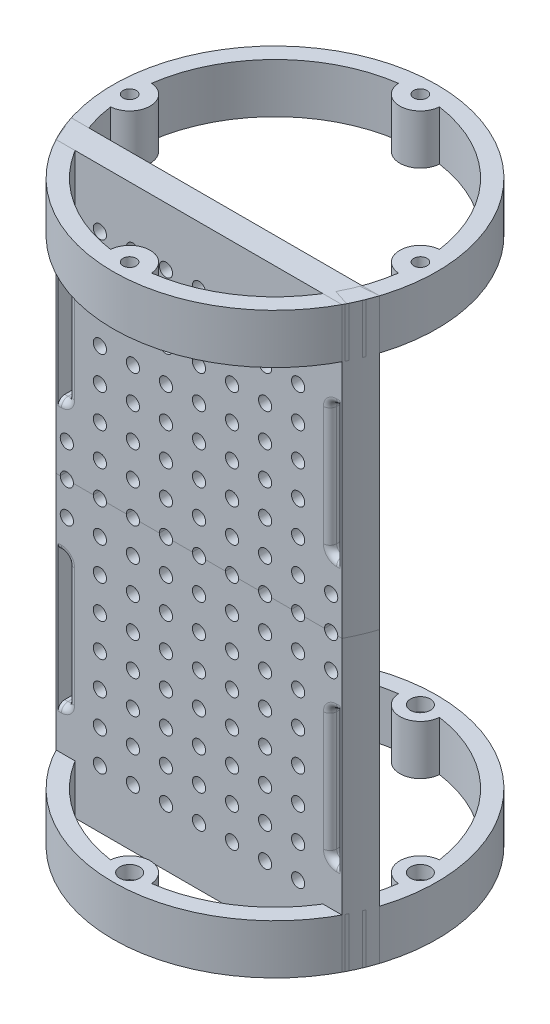
from build123d import *

# Parameters (mm, degrees)
SKETCH1_R                = 49
SKETCH1_R_2              = 1.55
BOSS_EXTRUDE1_DEPTH      = 15
BOSS_EXTRUDE2_DEPTH      = 72.5
BOSS_EXTRUDE2_DEPTH_BACK = 15
SKETCH3_R                = 3
CUT_EXTRUDE1_DEPTH       = 4
CIRPATTERN1_COUNT        = 4
SKETCH4_R                = 2
CUT_EXTRUDE2_DEPTH       = 15
CIRPATTERN2_COUNT        = 4
SKETCH6_R                = 2
CUT_EXTRUDE4_DEPTH       = 8
FILL_START               = 15
FILL_PATTERN1_OUTLINE_R  = 2
FILL_PATTERN1_DEPTH      = 8
SKETCH7_W                = 3
SKETCH7_H                = 40
CUT_EXTRUDE5_DEPTH       = 193.670703533
MIRROR9_COPY_1_SKETCH_W  = 3
MIRROR9_COPY_1_SKETCH_H  = 40
MIRROR9_COPY_1_DEPTH     = 193.670703533
FILLET2_R                = 2
FILLET3_R                = 2


# Read off the part's stored shape, not the designer's step: Fill Pattern1
with BuildPart() as part:
    # Sketch1 → Boss-Extrude1 (new body)
    with BuildSketch(Plane(origin=(0, 0, 0), x_dir=(1, 0, 0), z_dir=(0, 1, 0))):
        with Locations(Location((0, 0, 0), (0, 0, 270))):
            Circle(SKETCH1_R)
        with BuildLine():
            ThreePointArc((43.561522491, 6.196269703), (37.788235294, 0), (43.561522491, -6.196269703))
            ThreePointArc((43.561522491, -6.196269703), (31.112698372, -31.112698372), (6.196269703, -43.561522491))
            ThreePointArc((6.196269703, -43.561522491), (0, -37.788235294), (-6.196269703, -43.561522491))
            ThreePointArc((-6.196269703, -43.561522491), (-31.112698372, -31.112698372), (-43.561522491, -6.196269703))
            ThreePointArc((-43.561522491, -6.196269703), (-37.788235294, 0), (-43.561522491, 6.196269703))
            ThreePointArc((-43.561522491, 6.196269703), (-31.112698372, 31.112698372), (-6.196269703, 43.561522491))
            ThreePointArc((-6.196269703, 43.561522491), (0, 37.788235294), (6.196269703, 43.561522491))
            ThreePointArc((6.196269703, 43.561522491), (31.112698372, 31.112698372), (43.561522491, 6.196269703))
        make_face(mode=Mode.SUBTRACT)
        with Locations(Location((-44, 0, 0), (0, 0, 270))):
            Circle(SKETCH1_R_2, mode=Mode.SUBTRACT)
        with Locations(Location((0, -44, 0), (0, 0, 270))):
            Circle(SKETCH1_R_2, mode=Mode.SUBTRACT)
        with Locations(Location((0, 44, 0), (0, 0, 270))):
            Circle(SKETCH1_R_2, mode=Mode.SUBTRACT)
        with Locations(Location((44, 0, 0), (0, 0, 270))):
            Circle(SKETCH1_R_2, mode=Mode.SUBTRACT)
    extrude(amount=BOSS_EXTRUDE1_DEPTH)


with BuildPart() as body_2:
    # Sketch2 → Boss-Extrude2 (new, two sides: drawn at the far end of the back side and taken through both)
    with BuildSketch(Plane(origin=(0, 15, 0), x_dir=(1, 0, 0), z_dir=(0, 1, 0)).offset(-BOSS_EXTRUDE2_DEPTH_BACK)):
        with BuildLine():
            Line((-41.36423576, -15), (-46.647615159, -15))
            ThreePointArc((-46.647615159, -15), (-45.134711808, -19.07505675), (-43.266615306, -23))
            Line((-43.266615306, -23), (-37.509998667, -23))
            ThreePointArc((-37.509998667, -23), (-39.639452747, -19.09748114), (-41.36423576, -15))
        make_face()
        with BuildLine():
            Line((41.36423576, -15), (-41.36423576, -15))
            ThreePointArc((-41.36423576, -15), (-39.639452747, -19.09748114), (-37.509998667, -23))
            Line((-37.509998667, -23), (37.509998667, -23))
            ThreePointArc((37.509998667, -23), (39.639452747, -19.09748114), (41.36423576, -15))
        make_face()
        with BuildLine():
            Line((46.647615159, -15), (41.36423576, -15))
            ThreePointArc((41.36423576, -15), (39.639452747, -19.09748114), (37.509998667, -23))
            Line((37.509998667, -23), (43.266615306, -23))
            ThreePointArc((43.266615306, -23), (45.134711808, -19.07505675), (46.647615159, -15))
        make_face()
    extrude(amount=BOSS_EXTRUDE2_DEPTH + BOSS_EXTRUDE2_DEPTH_BACK)


with BuildPart() as body_3:
    # Mirror7: mirrored copy
    add(part.part.mirror(Plane(origin=(0, 87.5, 18.950111488), x_dir=(0, 0, 1), z_dir=(0, 1, 0))))

    # Sketch4 → Cut-Extrude2 (cut)
    with BuildSketch(Plane(origin=(0, 175, 0), x_dir=(1, 0, 0), z_dir=(0, 1, 0))):
        with Locations(Location((0, 44, 0), (0, 0, 270))):
            Circle(SKETCH4_R)
    cut_extrude2 = extrude(amount=-CUT_EXTRUDE2_DEPTH, mode=Mode.SUBTRACT)

    # CirPattern2: Cut-Extrude2 ×4 about axis
    cirpattern2_axis = Axis((0, 0, 0), (0, 1, 0))
    for i in range(1, CIRPATTERN2_COUNT):
        add(cut_extrude2.rotate(cirpattern2_axis, i * 360 / CIRPATTERN2_COUNT), mode=Mode.SUBTRACT)


with BuildPart() as body_4:
    # Mirror7 2: mirrored copy
    add(body_2.part.mirror(Plane(origin=(0, 87.5, 18.950111488), x_dir=(0, 0, 1), z_dir=(0, 1, 0))))


with BuildPart() as part_1:
    add(part.part)

    # Sketch3 → Cut-Extrude1 (cut)
    with BuildSketch(Plane(origin=(0, 15, 0), x_dir=(1, 0, 0), z_dir=(0, 1, 0))):
        with Locations(Location((0, 44, 0), (0, 0, 270))):
            Circle(SKETCH3_R)
    cut_extrude1 = extrude(amount=-CUT_EXTRUDE1_DEPTH, mode=Mode.SUBTRACT)

    # CirPattern1: Cut-Extrude1 ×4 about axis
    cirpattern1_axis = Axis((0, 0, 0), (0, 1, 0))
    for i in range(1, CIRPATTERN1_COUNT):
        add(cut_extrude1.rotate(cirpattern1_axis, i * 360 / CIRPATTERN1_COUNT), mode=Mode.SUBTRACT)


with BuildPart() as cut_extrude4_tool:
    # Sketch6 → Cut-Extrude4 (new body)
    with BuildSketch(Plane(origin=(0, 0, 15), x_dir=(-1, 0, 0), z_dir=(0, 0, -1))):
        with Locations((0, 87.5)):
            Circle(SKETCH6_R)
    extrude(amount=-CUT_EXTRUDE4_DEPTH)


with BuildPart() as body_2_1:
    add(body_2.part)

    # Cut-Extrude4: cut by cut_extrude4_tool
    add(cut_extrude4_tool.part, mode=Mode.SUBTRACT)


with BuildPart() as body_4_1:
    add(body_4.part)

    # Cut-Extrude4: cut by cut_extrude4_tool
    add(cut_extrude4_tool.part, mode=Mode.SUBTRACT)


with BuildPart() as fill_pattern1_tool:
    # Fill Pattern1 outline → Fill Pattern1 (new body)
    with BuildSketch(Plane.XY.offset(FILL_START)):
        with Locations((10, 97.5)):
            Circle(FILL_PATTERN1_OUTLINE_R)
        with Locations((0, 97.5)):
            Circle(FILL_PATTERN1_OUTLINE_R)
        with Locations((-10, 97.5)):
            Circle(FILL_PATTERN1_OUTLINE_R)
        with Locations((-10, 87.5)):
            Circle(FILL_PATTERN1_OUTLINE_R)
        with Locations((-40, 87.5)):
            Circle(FILL_PATTERN1_OUTLINE_R)
        with Locations((-30, 87.5)):
            Circle(FILL_PATTERN1_OUTLINE_R)
        with Locations((-20, 87.5)):
            Circle(FILL_PATTERN1_OUTLINE_R)
        with Locations((40, 87.5)):
            Circle(FILL_PATTERN1_OUTLINE_R)
        with Locations((30, 87.5)):
            Circle(FILL_PATTERN1_OUTLINE_R)
        with Locations((20, 87.5)):
            Circle(FILL_PATTERN1_OUTLINE_R)
        with Locations((10, 87.5)):
            Circle(FILL_PATTERN1_OUTLINE_R)
        with Locations((20, 107.5)):
            Circle(FILL_PATTERN1_OUTLINE_R)
        with Locations((10, 107.5)):
            Circle(FILL_PATTERN1_OUTLINE_R)
        with Locations((0, 107.5)):
            Circle(FILL_PATTERN1_OUTLINE_R)
        with Locations((-10, 107.5)):
            Circle(FILL_PATTERN1_OUTLINE_R)
        with Locations((-20, 107.5)):
            Circle(FILL_PATTERN1_OUTLINE_R)
        with Locations((-20, 97.5)):
            Circle(FILL_PATTERN1_OUTLINE_R)
        with Locations((20, 97.5)):
            Circle(FILL_PATTERN1_OUTLINE_R)
        with Locations((30, 117.5)):
            Circle(FILL_PATTERN1_OUTLINE_R)
        with Locations((20, 117.5)):
            Circle(FILL_PATTERN1_OUTLINE_R)
        with Locations((10, 117.5)):
            Circle(FILL_PATTERN1_OUTLINE_R)
        with Locations((0, 117.5)):
            Circle(FILL_PATTERN1_OUTLINE_R)
        with Locations((-10, 117.5)):
            Circle(FILL_PATTERN1_OUTLINE_R)
        with Locations((-20, 117.5)):
            Circle(FILL_PATTERN1_OUTLINE_R)
        with Locations((-30, 117.5)):
            Circle(FILL_PATTERN1_OUTLINE_R)
        with Locations((-30, 107.5)):
            Circle(FILL_PATTERN1_OUTLINE_R)
        with Locations((-30, 97.5)):
            Circle(FILL_PATTERN1_OUTLINE_R)
        with Locations((30, 97.5)):
            Circle(FILL_PATTERN1_OUTLINE_R)
        with Locations((30, 107.5)):
            Circle(FILL_PATTERN1_OUTLINE_R)
        with Locations((30, 127.5)):
            Circle(FILL_PATTERN1_OUTLINE_R)
        with Locations((20, 127.5)):
            Circle(FILL_PATTERN1_OUTLINE_R)
        with Locations((10, 127.5)):
            Circle(FILL_PATTERN1_OUTLINE_R)
        with Locations((0, 127.5)):
            Circle(FILL_PATTERN1_OUTLINE_R)
        with Locations((-10, 127.5)):
            Circle(FILL_PATTERN1_OUTLINE_R)
        with Locations((-20, 127.5)):
            Circle(FILL_PATTERN1_OUTLINE_R)
        with Locations((-30, 127.5)):
            Circle(FILL_PATTERN1_OUTLINE_R)
        with Locations((-40, 97.5)):
            Circle(FILL_PATTERN1_OUTLINE_R)
        with Locations((40, 97.5)):
            Circle(FILL_PATTERN1_OUTLINE_R)
        with Locations((30, 137.5)):
            Circle(FILL_PATTERN1_OUTLINE_R)
        with Locations((20, 137.5)):
            Circle(FILL_PATTERN1_OUTLINE_R)
        with Locations((10, 137.5)):
            Circle(FILL_PATTERN1_OUTLINE_R)
        with Locations((0, 137.5)):
            Circle(FILL_PATTERN1_OUTLINE_R)
        with Locations((-10, 137.5)):
            Circle(FILL_PATTERN1_OUTLINE_R)
        with Locations((-20, 137.5)):
            Circle(FILL_PATTERN1_OUTLINE_R)
        with Locations((-30, 137.5)):
            Circle(FILL_PATTERN1_OUTLINE_R)
        with Locations((30, 147.5)):
            Circle(FILL_PATTERN1_OUTLINE_R)
        with Locations((20, 147.5)):
            Circle(FILL_PATTERN1_OUTLINE_R)
        with Locations((10, 147.5)):
            Circle(FILL_PATTERN1_OUTLINE_R)
        with Locations((0, 147.5)):
            Circle(FILL_PATTERN1_OUTLINE_R)
        with Locations((-10, 147.5)):
            Circle(FILL_PATTERN1_OUTLINE_R)
        with Locations((-20, 147.5)):
            Circle(FILL_PATTERN1_OUTLINE_R)
        with Locations((-30, 147.5)):
            Circle(FILL_PATTERN1_OUTLINE_R)
        with Locations((30, 157.5)):
            Circle(FILL_PATTERN1_OUTLINE_R)
        with Locations((20, 157.5)):
            Circle(FILL_PATTERN1_OUTLINE_R)
        with Locations((10, 157.5)):
            Circle(FILL_PATTERN1_OUTLINE_R)
        with Locations((0, 157.5)):
            Circle(FILL_PATTERN1_OUTLINE_R)
        with Locations((-10, 157.5)):
            Circle(FILL_PATTERN1_OUTLINE_R)
        with Locations((-20, 157.5)):
            Circle(FILL_PATTERN1_OUTLINE_R)
        with Locations((-30, 157.5)):
            Circle(FILL_PATTERN1_OUTLINE_R)
        with Locations((-10, 77.5)):
            Circle(FILL_PATTERN1_OUTLINE_R)
        with Locations((0, 77.5)):
            Circle(FILL_PATTERN1_OUTLINE_R)
        with Locations((10, 77.5)):
            Circle(FILL_PATTERN1_OUTLINE_R)
        with Locations((-20, 77.5)):
            Circle(FILL_PATTERN1_OUTLINE_R)
        with Locations((-20, 67.5)):
            Circle(FILL_PATTERN1_OUTLINE_R)
        with Locations((-10, 67.5)):
            Circle(FILL_PATTERN1_OUTLINE_R)
        with Locations((0, 67.5)):
            Circle(FILL_PATTERN1_OUTLINE_R)
        with Locations((10, 67.5)):
            Circle(FILL_PATTERN1_OUTLINE_R)
        with Locations((20, 67.5)):
            Circle(FILL_PATTERN1_OUTLINE_R)
        with Locations((20, 77.5)):
            Circle(FILL_PATTERN1_OUTLINE_R)
        with Locations((-30, 77.5)):
            Circle(FILL_PATTERN1_OUTLINE_R)
        with Locations((-30, 67.5)):
            Circle(FILL_PATTERN1_OUTLINE_R)
        with Locations((-30, 57.5)):
            Circle(FILL_PATTERN1_OUTLINE_R)
        with Locations((-20, 57.5)):
            Circle(FILL_PATTERN1_OUTLINE_R)
        with Locations((-10, 57.5)):
            Circle(FILL_PATTERN1_OUTLINE_R)
        with Locations((0, 57.5)):
            Circle(FILL_PATTERN1_OUTLINE_R)
        with Locations((10, 57.5)):
            Circle(FILL_PATTERN1_OUTLINE_R)
        with Locations((20, 57.5)):
            Circle(FILL_PATTERN1_OUTLINE_R)
        with Locations((30, 57.5)):
            Circle(FILL_PATTERN1_OUTLINE_R)
        with Locations((30, 67.5)):
            Circle(FILL_PATTERN1_OUTLINE_R)
        with Locations((30, 77.5)):
            Circle(FILL_PATTERN1_OUTLINE_R)
        with Locations((-40, 77.5)):
            Circle(FILL_PATTERN1_OUTLINE_R)
        with Locations((-30, 47.5)):
            Circle(FILL_PATTERN1_OUTLINE_R)
        with Locations((-20, 47.5)):
            Circle(FILL_PATTERN1_OUTLINE_R)
        with Locations((-10, 47.5)):
            Circle(FILL_PATTERN1_OUTLINE_R)
        with Locations((0, 47.5)):
            Circle(FILL_PATTERN1_OUTLINE_R)
        with Locations((10, 47.5)):
            Circle(FILL_PATTERN1_OUTLINE_R)
        with Locations((20, 47.5)):
            Circle(FILL_PATTERN1_OUTLINE_R)
        with Locations((30, 47.5)):
            Circle(FILL_PATTERN1_OUTLINE_R)
        with Locations((40, 77.5)):
            Circle(FILL_PATTERN1_OUTLINE_R)
        with Locations((-30, 37.5)):
            Circle(FILL_PATTERN1_OUTLINE_R)
        with Locations((-20, 37.5)):
            Circle(FILL_PATTERN1_OUTLINE_R)
        with Locations((-10, 37.5)):
            Circle(FILL_PATTERN1_OUTLINE_R)
        with Locations((0, 37.5)):
            Circle(FILL_PATTERN1_OUTLINE_R)
        with Locations((10, 37.5)):
            Circle(FILL_PATTERN1_OUTLINE_R)
        with Locations((20, 37.5)):
            Circle(FILL_PATTERN1_OUTLINE_R)
        with Locations((30, 37.5)):
            Circle(FILL_PATTERN1_OUTLINE_R)
        with Locations((-30, 27.5)):
            Circle(FILL_PATTERN1_OUTLINE_R)
        with Locations((-20, 27.5)):
            Circle(FILL_PATTERN1_OUTLINE_R)
        with Locations((-10, 27.5)):
            Circle(FILL_PATTERN1_OUTLINE_R)
        with Locations((0, 27.5)):
            Circle(FILL_PATTERN1_OUTLINE_R)
        with Locations((10, 27.5)):
            Circle(FILL_PATTERN1_OUTLINE_R)
        with Locations((20, 27.5)):
            Circle(FILL_PATTERN1_OUTLINE_R)
        with Locations((30, 27.5)):
            Circle(FILL_PATTERN1_OUTLINE_R)
        with Locations((-30, 17.5)):
            Circle(FILL_PATTERN1_OUTLINE_R)
        with Locations((-20, 17.5)):
            Circle(FILL_PATTERN1_OUTLINE_R)
        with Locations((-10, 17.5)):
            Circle(FILL_PATTERN1_OUTLINE_R)
        with Locations((0, 17.5)):
            Circle(FILL_PATTERN1_OUTLINE_R)
        with Locations((10, 17.5)):
            Circle(FILL_PATTERN1_OUTLINE_R)
        with Locations((20, 17.5)):
            Circle(FILL_PATTERN1_OUTLINE_R)
        with Locations((30, 17.5)):
            Circle(FILL_PATTERN1_OUTLINE_R)
    extrude(amount=FILL_PATTERN1_DEPTH)


with BuildPart() as body_2_2:
    add(body_2_1.part)

    # Fill Pattern1: cut by fill_pattern1_tool
    add(fill_pattern1_tool.part, mode=Mode.SUBTRACT)


with BuildPart() as body_4_2:
    add(body_4_1.part)

    # Fill Pattern1: cut by fill_pattern1_tool
    add(fill_pattern1_tool.part, mode=Mode.SUBTRACT)

    # Sketch7 → Cut-Extrude5 (cut, through all)
    with BuildSketch(Plane(origin=(0, 0, 15), x_dir=(-1, 0, 0), z_dir=(0, 0, -1))):
        with Locations((-41.147615159, 127.5)):
            Rectangle(SKETCH7_W, SKETCH7_H)
    cut_extrude5 = extrude(amount=-CUT_EXTRUDE5_DEPTH, mode=Mode.SUBTRACT)

    # Mirror8: Cut-Extrude5 across plane
    add(cut_extrude5.mirror(Plane(origin=(0, 0, 0), x_dir=(0, 0, 1), z_dir=(1, 0, 0))), mode=Mode.SUBTRACT)

    # Fillet2
    fillet2_edges = [body_4_2.edges().sort_by_distance(p)[0] for p in [
        (41.147615159, 107.5, 23),
        (39.647615159, 127.5, 23),
        (41.147615159, 147.5, 23),
        (39.647615159, 147.5, 19),
        (39.647615159, 107.5, 19),
        (41.147615159, 107.5, 15),
        (39.647615159, 127.5, 15),
        (41.147615159, 147.5, 15),
        (-41.147615159, 107.5, 15),
        (-39.647615159, 127.5, 15),
        (-39.647615159, 107.5, 19),
        (-41.147615159, 147.5, 15),
        (-39.647615159, 147.5, 19),
        (-41.147615159, 107.5, 23),
        (-39.647615159, 127.5, 23),
        (-41.147615159, 147.5, 23),
    ]]
    fillet(fillet2_edges, radius=FILLET2_R)


with BuildPart() as body_2_3:
    add(body_2_2.part)

    # Mirror9: Cut-Extrude5 across plane
    add(cut_extrude5.mirror(Plane(origin=(0, 87.5, 0), x_dir=(0, 0, 1), z_dir=(0, -1, 0))), mode=Mode.SUBTRACT)

    # Mirror9 copy 1 sketch → Mirror9 copy 1 (cut, through all)
    with BuildSketch(Plane(origin=(0, 175, 15), x_dir=(1, 0, 0), z_dir=(0, 0, -1))):
        with Locations((-41.147615159, 127.5)):
            Rectangle(MIRROR9_COPY_1_SKETCH_W, MIRROR9_COPY_1_SKETCH_H)
    extrude(amount=-MIRROR9_COPY_1_DEPTH, mode=Mode.SUBTRACT)

    # Fillet3
    fillet3_edges = [body_2_3.edges().sort_by_distance(p)[0] for p in [
        (-41.147615159, 67.5, 15),
        (-39.647615159, 47.5, 15),
        (-41.147615159, 27.5, 15),
        (-41.147615159, 67.5, 23),
        (-39.647615159, 67.5, 19),
        (-39.647615159, 47.5, 23),
        (-39.647615159, 27.5, 19),
        (-41.147615159, 27.5, 23),
        (41.147615159, 27.5, 23),
        (39.647615159, 27.5, 19),
        (41.147615159, 27.5, 15),
        (39.647615159, 47.5, 23),
        (39.647615159, 67.5, 19),
        (39.647615159, 47.5, 15),
        (41.147615159, 67.5, 23),
        (41.147615159, 67.5, 15),
    ]]
    fillet(fillet3_edges, radius=FILLET3_R)


solid = Compound([body_3.part, part_1.part, body_4_2.part, body_2_3.part])
